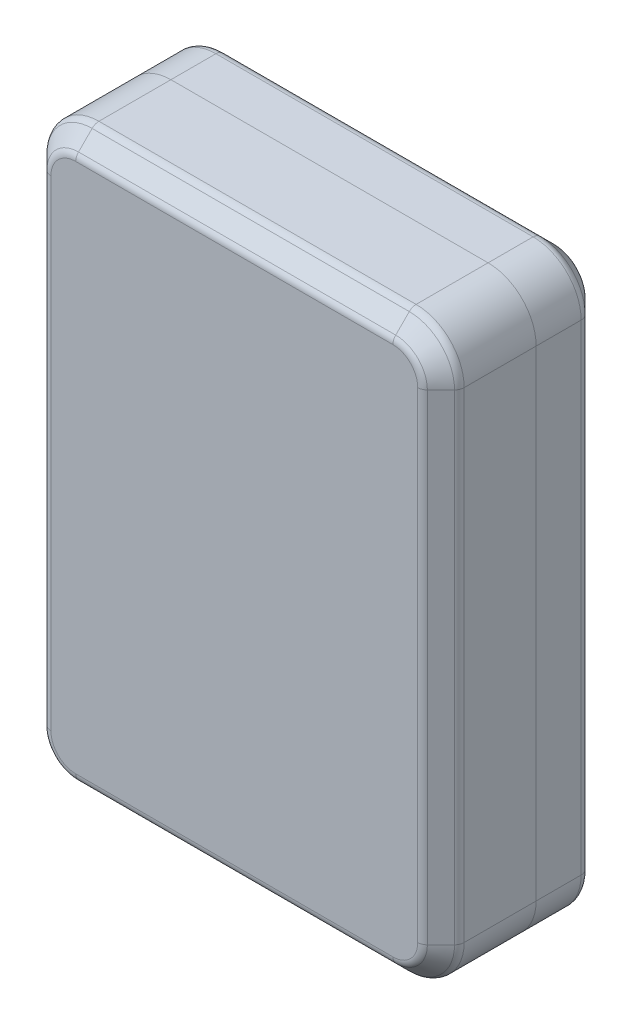
from build123d import *

# Parameters (mm, degrees)
BOSS_EXTRUDE1_DEPTH      = 13
BOSS_EXTRUDE1_DEPTH_BACK = 4
SKETCH1_W                = 43
SKETCH1_H                = 60
FILLET1_R                = 5
CHAMFER1_SIZE            = 2
FILLET2_R                = 1
SHELL1_T                 = 0.7
CUT_EXTRUDE1_REACH       = 56.019
SPLIT1_SURFACE_1_BACK    = 76.75
SPLIT1_SURFACE_1_DEPTH   = 153.5
SPLIT1_SURFACE_2_BACK    = 76.75
SPLIT1_SURFACE_2_DEPTH   = 153.5


with BuildPart() as part:
    # Sketch1 → Boss-Extrude1 (new, two sides: drawn at the far end of the back side and taken through both)
    with BuildSketch(Plane.XY.offset(-BOSS_EXTRUDE1_DEPTH_BACK)):
        Rectangle(SKETCH1_W, SKETCH1_H)
    extrude(amount=BOSS_EXTRUDE1_DEPTH + BOSS_EXTRUDE1_DEPTH_BACK)

    # Fillet1
    fillet1_edges = [part.edges().sort_by_distance(p)[0] for p in [
        (-21.5, -30, 4.5),
        (-21.5, 30, 4.5),
        (21.5, 30, 4.5),
        (21.5, -30, 4.5),
    ]]
    fillet(fillet1_edges, radius=FILLET1_R)

    # Chamfer1
    chamfer1_edges = [part.edges().sort_by_distance(p)[0] for p in [
        (0, 30, 13),
        (0, 30, -4),
        (0, -30, 13),
        (21.5, 0, 13),
        (-21.5, 0, 13),
        (-20.035533906, -28.535533906, 13),
        (20.035533906, -28.535533906, 13),
        (20.035533906, 28.535533906, 13),
        (-20.035533906, 28.535533906, 13),
        (-21.5, 0, -4),
        (0, -30, -4),
        (21.5, 0, -4),
        (-20.035533906, -28.535533906, -4),
        (20.035533906, -28.535533906, -4),
        (20.035533906, 28.535533906, -4),
        (-20.035533906, 28.535533906, -4),
    ]]
    chamfer(chamfer1_edges, length=CHAMFER1_SIZE)

    # Fillet2
    fillet2_edges = [part.edges().sort_by_distance(p)[0] for p in [
        (-19.5, 0, -4),
        (-18.621320344, -27.121320344, -4),
        (0, -28, -4),
        (18.621320344, -27.121320344, -4),
        (19.5, 0, -4),
        (18.621320344, 27.121320344, -4),
        (0, 28, -4),
        (-18.621320344, 27.121320344, -4),
        (-20.035533906, 28.535533906, 11),
        (-20.035533906, 28.535533906, -2),
        (0, 30, 11),
        (0, 30, -2),
        (20.035533906, 28.535533906, 11),
        (20.035533906, 28.535533906, -2),
        (21.5, 0, 11),
        (21.5, 0, -2),
        (20.035533906, -28.535533906, 11),
        (20.035533906, -28.535533906, -2),
        (0, -30, 11),
        (0, -30, -2),
        (-20.035533906, -28.535533906, 11),
        (-20.035533906, -28.535533906, -2),
        (-21.5, 0, 11),
        (-21.5, 0, -2),
        (-19.5, 0, 13),
        (-18.621320344, -27.121320344, 13),
        (0, -28, 13),
        (18.621320344, -27.121320344, 13),
        (19.5, 0, 13),
        (18.621320344, 27.121320344, 13),
        (0, 28, 13),
        (-18.621320344, 27.121320344, 13),
    ]]
    fillet(fillet2_edges, radius=FILLET2_R)

    # Shell1 (no face opened: a closed hollow body)
    add(offset(amount=-SHELL1_T, mode=Mode.PRIVATE), mode=Mode.SUBTRACT)

    # Sketch3 → Cut-Extrude1 (cut, up to next)
    with BuildSketch(Plane.ZY.offset(21.5), mode=Mode.PRIVATE) as cut_extrude1_sk1:
        with BuildLine():
            Line((1.31583373, 3.192485), (1.31583373, 0.052485))
            ThreePointArc((1.31583373, 0.052485), (1.755173559, -1.008175172), (2.81583373, -1.447515))
            Line((2.81583373, -1.447515), (3.37583373, -1.447515))
            ThreePointArc((3.37583373, -1.447515), (4.436493902, -1.008175172), (4.87583373, 0.052485))
            Line((4.87583373, 0.052485), (4.87583373, 6.392485))
            ThreePointArc((4.87583373, 6.392485), (4.436493902, 7.453145172), (3.37583373, 7.892485))
            Line((3.37583373, 7.892485), (2.81583373, 7.892485))
            ThreePointArc((2.81583373, 7.892485), (1.755173559, 7.453145172), (1.31583373, 6.392485))
            Line((1.31583373, 6.392485), (1.31583373, 3.202485))
            Line((1.31583373, 3.202485), (1.31583373, 3.192485))
        make_face()
    cut_extrude1_tool1 = extrude(cut_extrude1_sk1.sketch, amount=-CUT_EXTRUDE1_REACH, mode=Mode.PRIVATE) & part.part
    # Sketch3 → Cut-Extrude1 (cut, up to next)
    with BuildSketch(Plane.ZY.offset(21.5), mode=Mode.PRIVATE) as cut_extrude1_sk2:
        with BuildLine():
            Line((5.545, 22.392485), (5.545, 13.892485))
            ThreePointArc((5.545, 13.892485), (5.486421356, 13.751063644), (5.345, 13.692485))
            Line((5.345, 13.692485), (1.845, 13.692485))
            ThreePointArc((1.845, 13.692485), (1.703578644, 13.751063644), (1.645, 13.892485))
            Line((1.645, 13.892485), (1.645, 22.392485))
            ThreePointArc((1.645, 22.392485), (1.703578644, 22.533906356), (1.845, 22.592485))
            Line((1.845, 22.592485), (5.345, 22.592485))
            ThreePointArc((5.345, 22.592485), (5.486421356, 22.533906356), (5.545, 22.392485))
        make_face()
    cut_extrude1_tool2 = extrude(cut_extrude1_sk2.sketch, amount=-CUT_EXTRUDE1_REACH, mode=Mode.PRIVATE) & part.part
    add(cut_extrude1_tool1.solids().sort_by_distance((-21.5, 3.222485, 3.095834))[0], mode=Mode.SUBTRACT)
    add(cut_extrude1_tool2.solids().sort_by_distance((-21.5, 18.142485, 3.595))[0], mode=Mode.SUBTRACT)

    # Cut-Extrude3: read off the stored shape, not the designer's step
    # Cut-Extrude3: loft between two sections, ruled curve by curve
    cut_extrude3_from = [
        Edge.make_three_point_arc((19.085786438, -20.493015779, -3.124764429), (12.970294127, -23.288177809, -3.124764429), (10.175132098, -17.172685499, -3.124764429)),
        Edge.make_three_point_arc((10.175132098, -17.172685499, -3.124764429), (16.290624408, -14.377523469, -3.124764429), (19.085786438, -20.493015779, -3.124764429)),
    ]
    cut_extrude3_to = [
        Edge.make_three_point_arc((19.085786438, -20.493015779, -4), (12.970294127, -23.288177809, -4), (10.175132098, -17.172685499, -4)),
        Edge.make_three_point_arc((10.175132098, -17.172685499, -4), (16.290624408, -14.377523469, -4), (19.085786438, -20.493015779, -4)),
    ]
    cut_extrude3 = Solid(Shell([*[Face.make_surface_from_curves(cut_extrude3_from[k], cut_extrude3_to[k]) for k in range(2)], Face(Wire(cut_extrude3_from)), Face(Wire(cut_extrude3_to))]))
    add(cut_extrude3, mode=Mode.SUBTRACT)

    # Cut-Extrude3 2: loft between two sections, ruled curve by curve
    cut_extrude3_2_from = [
        Edge.make_three_point_arc((-17.854548957, -18.832850639, -3.3), (-13.040956, -14.019257681, -3.3), (-8.227363043, -18.832850639, -3.3)),
        Edge.make_three_point_arc((-8.227363043, -18.832850639, -3.3), (-13.040956, -23.646443596, -3.3), (-17.854548957, -18.832850639, -3.3)),
    ]
    cut_extrude3_2_to = [
        Edge.make_three_point_arc((-17.854548957, -18.832850639, -4), (-13.040956, -14.019257681, -4), (-8.227363043, -18.832850639, -4)),
        Edge.make_three_point_arc((-8.227363043, -18.832850639, -4), (-13.040956, -23.646443596, -4), (-17.854548957, -18.832850639, -4)),
    ]
    cut_extrude3_2 = Solid(Shell([*[Face.make_surface_from_curves(cut_extrude3_2_from[k], cut_extrude3_2_to[k]) for k in range(2)], Face(Wire(cut_extrude3_2_from)), Face(Wire(cut_extrude3_2_to))]))
    add(cut_extrude3_2, mode=Mode.SUBTRACT)


with BuildPart() as body_2:
    # Split1: the piece behind the surface
    add(part.part)
    # Split1 surface: a surface, the sketch's curves swept straight by 153.5 mm
    with BuildLine(Plane(origin=(0, 0, 0), x_dir=(0, 0, -1), z_dir=(1, 0, 0)).offset(-SPLIT1_SURFACE_1_BACK), mode=Mode.PRIVATE) as split1_surface_1_path:
        Line((-3.09583373, 30), (-3.09583373, -30))
    split1_surface_1 = Shell.extrude(split1_surface_1_path.wire(), (1 * SPLIT1_SURFACE_1_DEPTH, 0 * SPLIT1_SURFACE_1_DEPTH, 0 * SPLIT1_SURFACE_1_DEPTH))
    split(bisect_by=split1_surface_1, keep=Keep.BOTTOM)


with BuildPart() as part_1:
    add(part.part)

    # Split1: split by a surface, the side it looks to stays
    # Split1 surface: a surface, the sketch's curves swept straight by 153.5 mm
    with BuildLine(Plane(origin=(0, 0, 0), x_dir=(0, 0, -1), z_dir=(1, 0, 0)).offset(-SPLIT1_SURFACE_2_BACK), mode=Mode.PRIVATE) as split1_surface_2_path:
        Line((-3.09583373, 30), (-3.09583373, -30))
    split1_surface_2 = Shell.extrude(split1_surface_2_path.wire(), (1 * SPLIT1_SURFACE_2_DEPTH, 0 * SPLIT1_SURFACE_2_DEPTH, 0 * SPLIT1_SURFACE_2_DEPTH))
    split(bisect_by=split1_surface_2, keep=Keep.TOP)


solid = Compound([body_2.part, part_1.part])
